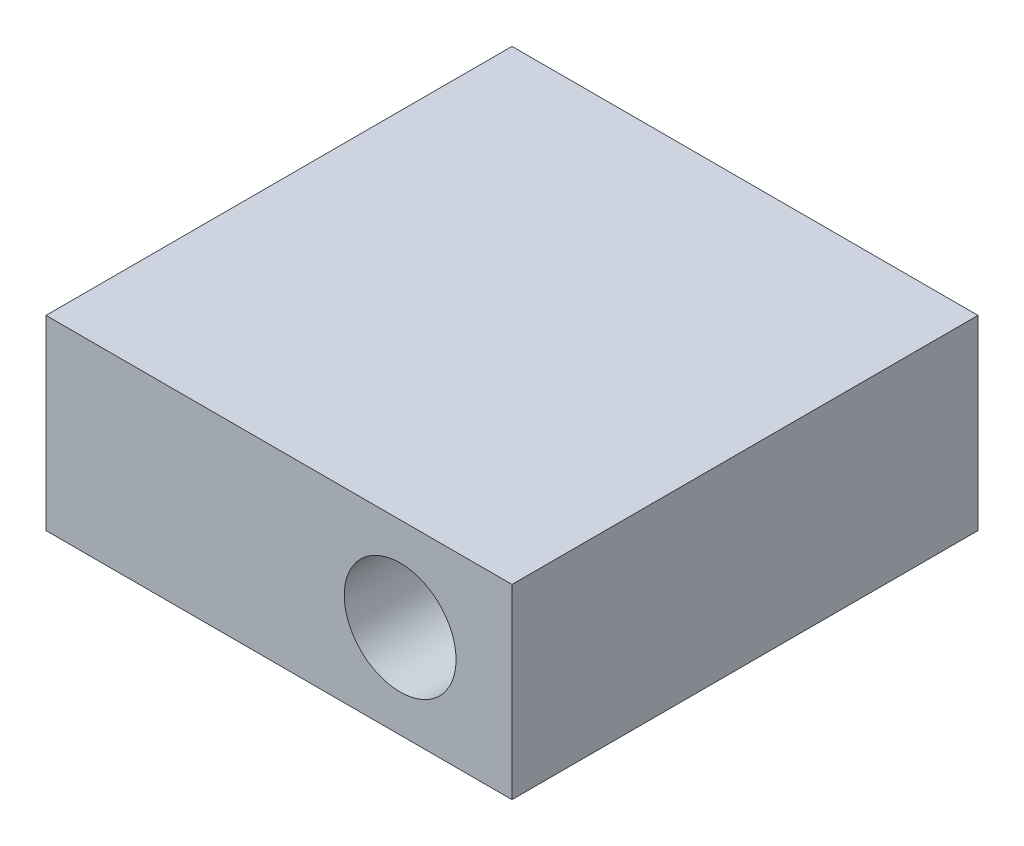
from build123d import *

# Parameters (mm, degrees)
SKETCH1_W           = 25
SKETCH1_H           = 25
BOSS_EXTRUDE1_DEPTH = 10
SKETCH2_R           = 3
CUT_EXTRUDE1_DEPTH  = 10


with BuildPart() as part:
    # Sketch1 → Boss-Extrude1 (new body)
    with BuildSketch(Plane(origin=(0, 0, 0), x_dir=(1, 0, 0), z_dir=(0, 1, 0))):
        Rectangle(SKETCH1_W, SKETCH1_H)
    extrude(amount=BOSS_EXTRUDE1_DEPTH)

    # Sketch2 → Cut-Extrude1 (cut)
    with BuildSketch(Plane.XY.offset(12.5)):
        with Locations((6.5, 5)):
            Circle(SKETCH2_R)
    extrude(amount=-CUT_EXTRUDE1_DEPTH, mode=Mode.SUBTRACT)


solid = part.part
